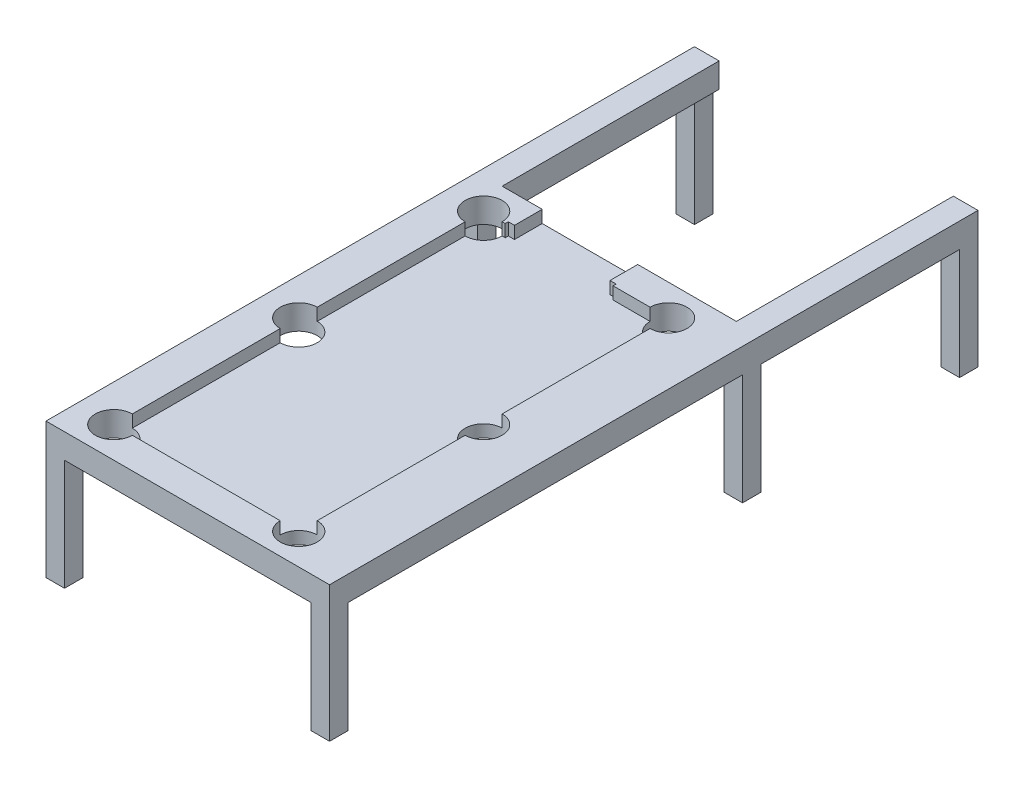
from build123d import *

# Parameters (mm, degrees)
SKETCH2_W           = 460
SKETCH2_H           = 700
SKETCH2_W_2         = 300
SKETCH2_H_2         = 600
BOSS_EXTRUDE1_DEPTH = 20
SKETCH10_W          = 460
SKETCH10_H          = 700
BOSS_EXTRUDE6_DEPTH = 20
SKETCH11_W          = 30
SKETCH11_H          = 30
BOSS_EXTRUDE7_DEPTH = 180
SKETCH14_W          = 40
SKETCH14_H          = 352
BOSS_EXTRUDE8_DEPTH = 40
SKETCH15_W          = 30
SKETCH15_H          = 30
BOSS_EXTRUDE9_DEPTH = 180
SKETCH17_R          = 30
CUT_EXTRUDE1_DEPTH  = 60
CUT_EXTRUDE2_DEPTH  = 20


with BuildPart() as part:
    # Sketch2 → Boss-Extrude1 (new body)
    with BuildSketch(Plane(origin=(0, 0, 0), x_dir=(1, 0, 0), z_dir=(0, 1, 0))):
        with Locations((230, 350)):
            Rectangle(SKETCH2_W, SKETCH2_H)
        with Locations((210, 350)):
            Rectangle(SKETCH2_W_2, SKETCH2_H_2, mode=Mode.SUBTRACT)
    extrude(amount=BOSS_EXTRUDE1_DEPTH)

    # Sketch10 → Boss-Extrude6 (add)
    with BuildSketch(Plane.XZ):
        with Locations((230, -350)):
            Rectangle(SKETCH10_W, SKETCH10_H)
    extrude(amount=BOSS_EXTRUDE6_DEPTH)

    # Sketch11 → Boss-Extrude7 (add)
    with BuildSketch(Plane.XZ.offset(20)):
        with Locations((15, -15)):
            Rectangle(SKETCH11_W, SKETCH11_H)
        with Locations((445, -15)):
            Rectangle(SKETCH11_W, SKETCH11_H)
        with Locations((15, -685)):
            Rectangle(SKETCH11_W, SKETCH11_H)
        with Locations((445, -685)):
            Rectangle(SKETCH11_W, SKETCH11_H)
    extrude(amount=BOSS_EXTRUDE7_DEPTH)

    # Sketch14 → Boss-Extrude8 (add)
    with BuildSketch(Plane(origin=(0, 20, 0), x_dir=(1, 0, 0), z_dir=(0, 1, 0))):
        with Locations((20, 876)):
            Rectangle(SKETCH14_W, SKETCH14_H)
        with Locations((440, 876)):
            Rectangle(SKETCH14_W, SKETCH14_H)
    extrude(amount=-BOSS_EXTRUDE8_DEPTH)

    # Sketch15 → Boss-Extrude9 (add)
    with BuildSketch(Plane.XZ.offset(20)):
        with Locations((445, -1037)):
            Rectangle(SKETCH15_W, SKETCH15_H)
        with Locations((15, -1037)):
            Rectangle(SKETCH15_W, SKETCH15_H)
    extrude(amount=BOSS_EXTRUDE9_DEPTH)

    # Sketch17 → Cut-Extrude1 (cut)
    with BuildSketch(Plane(origin=(0, 20, 0), x_dir=(1, 0, 0), z_dir=(0, 1, 0))):
        with Locations((60, 650)):
            Circle(SKETCH17_R)
        with Locations((360, 650)):
            Circle(SKETCH17_R)
        with Locations((60, 350)):
            Circle(SKETCH17_R)
        with Locations((360, 350)):
            Circle(SKETCH17_R)
        with Locations((60, 50)):
            Circle(SKETCH17_R)
        with Locations((360, 50)):
            Circle(SKETCH17_R)
    extrude(amount=-CUT_EXTRUDE1_DEPTH, mode=Mode.SUBTRACT)

    # Sketch18 → Cut-Extrude2 (cut)
    with BuildSketch(Plane(origin=(0, 20, 0), x_dir=(1, 0, 0), z_dir=(0, 1, 0))):
        Polygon((270, 655), (260, 655), (260, 700), (105, 700), (105, 655), (95, 655), (95, 650), (270, 650), align=None)
    extrude(amount=-CUT_EXTRUDE2_DEPTH, mode=Mode.SUBTRACT)


solid = part.part
